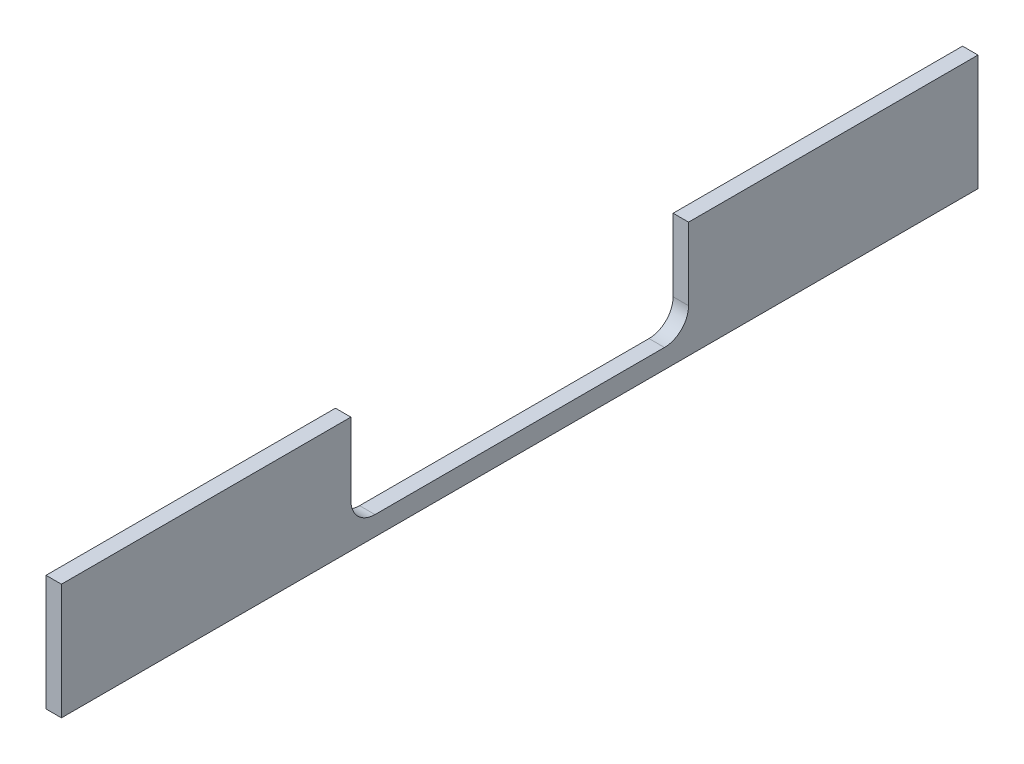
from build123d import *

# Parameters (mm, degrees)
SKETCH1_W           = 190
SKETCH1_H           = 24
BOSS_EXTRUDE1_DEPTH = 3.2
SKETCH2_W           = 70
SKETCH2_H           = 20
CUT_EXTRUDE1_DEPTH  = 10
FILLET1_R           = 5


with BuildPart() as part:
    # Sketch1 → Boss-Extrude1 (new body)
    with BuildSketch(Plane(origin=(0, 0, 0), x_dir=(0, 0, -1), z_dir=(1, 0, 0))):
        with Locations((95, 12)):
            Rectangle(SKETCH1_W, SKETCH1_H)
    extrude(amount=BOSS_EXTRUDE1_DEPTH)

    # Sketch2 → Cut-Extrude1 (cut)
    with BuildSketch(Plane.ZY):
        with Locations((-95, 14)):
            Rectangle(SKETCH2_W, SKETCH2_H)
    extrude(amount=-CUT_EXTRUDE1_DEPTH, mode=Mode.SUBTRACT)

    # Fillet1
    fillet1_edges = [part.edges().sort_by_distance(p)[0] for p in [
        (1.6, 4, -60),
        (1.6, 4, -130),
    ]]
    fillet(fillet1_edges, radius=FILLET1_R)


solid = part.part
